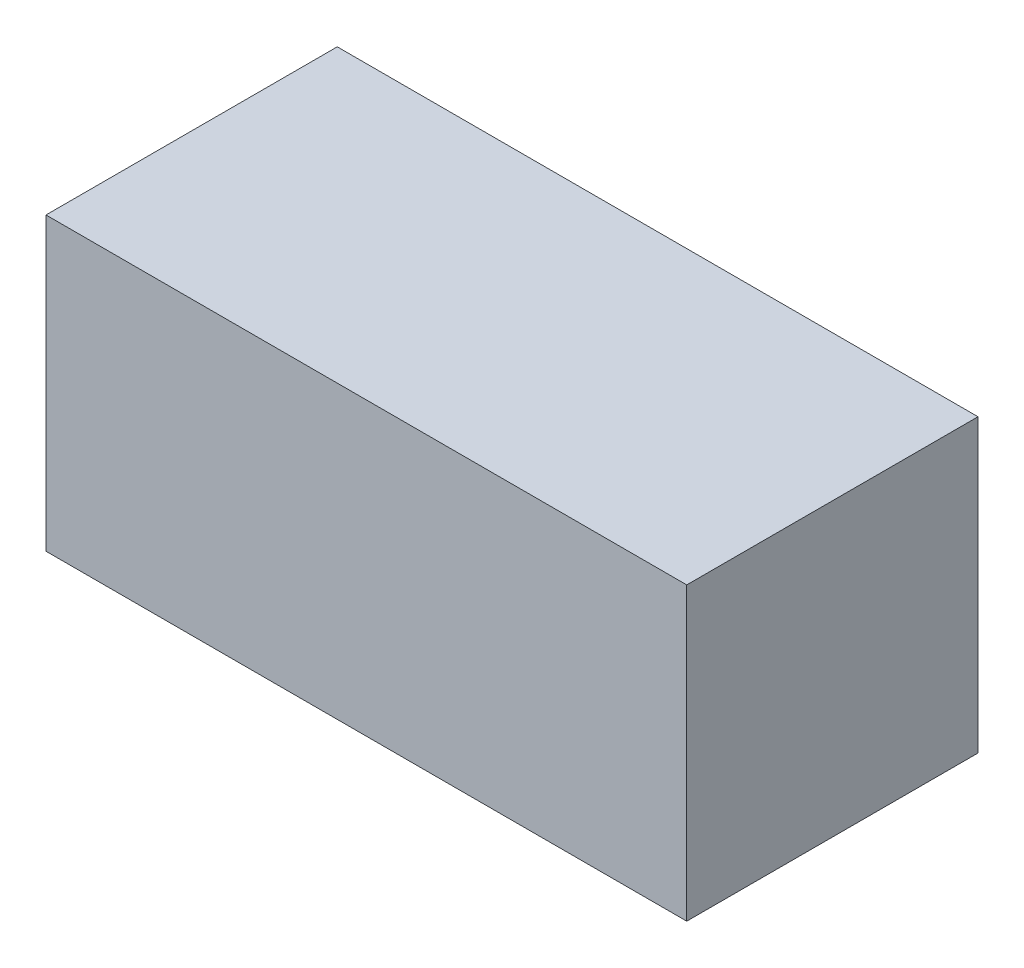
from build123d import *

# Parameters (mm, degrees)
SKETCH1_W           = 110
SKETCH1_H           = 50
BOSS_EXTRUDE1_DEPTH = 50


with BuildPart() as part:
    # Sketch1 → Boss-Extrude1 (new body)
    with BuildSketch(Plane.XY):
        Rectangle(SKETCH1_W, SKETCH1_H)
    extrude(amount=BOSS_EXTRUDE1_DEPTH)


solid = part.part
